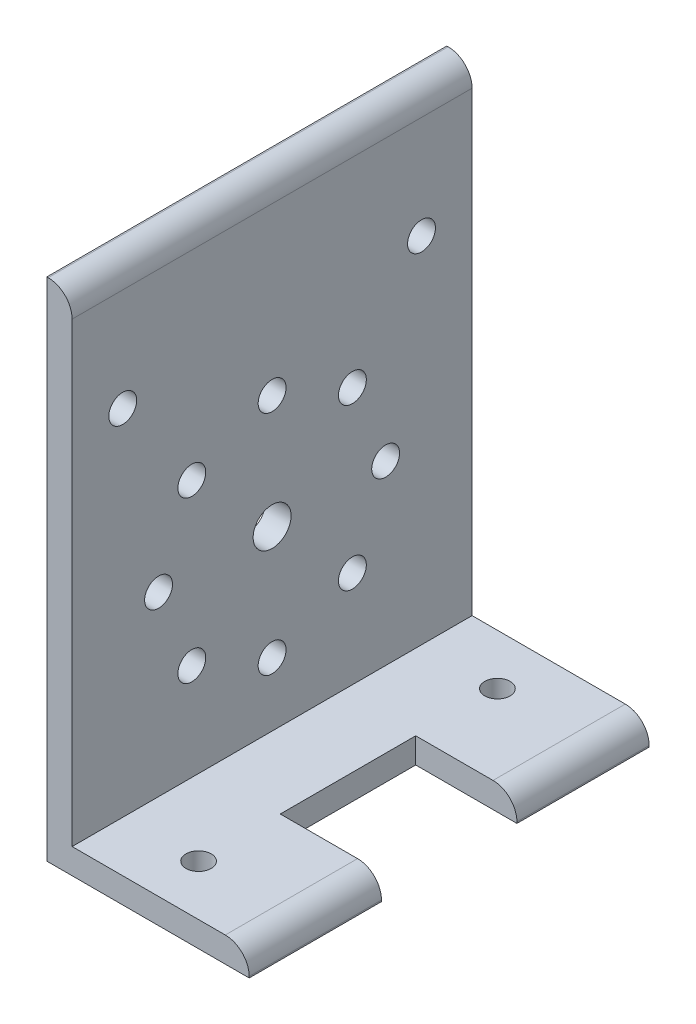
from build123d import *

# Parameters (mm, degrees)
BOSS_EXTRUDE1_DEPTH = 100.4
SKETCH2_R           = 4.7625
SKETCH2_R_2         = 3.5
CUT_EXTRUDE1_DEPTH  = 170.675572785
SKETCH3_R           = 3.175
CUT_EXTRUDE2_DEPTH  = 165.976430135
CUT_EXTRUDE3_DEPTH  = 165.976430135
SKETCH5_R           = 3.5
CUT_EXTRUDE4_DEPTH  = 10


with BuildPart() as part:
    # Sketch1 → Boss-Extrude1 (new body)
    with BuildSketch(Plane.XY):
        with BuildLine():
            Line((44.8, 6.35), (12.35, 6.35))
            Line((12.35, 6.35), (6.35, 6.35))
            Line((6.35, 6.35), (6.35, 37.75))
            Line((6.35, 37.75), (6.35, 121))
            ThreePointArc((6.35, 121), (4.592640687, 125.242640687), (0.35, 127))
            Line((0.35, 127), (0, 127))
            Line((0, 127), (0, 6.35))
            Line((0, 6.35), (0, 0))
            Line((0, 0), (6.35, 0))
            Line((6.35, 0), (50.8, 0))
            Line((50.8, 0), (50.8, 0.35))
            ThreePointArc((50.8, 0.35), (49.042640687, 4.592640687), (44.8, 6.35))
        make_face()
    extrude(amount=BOSS_EXTRUDE1_DEPTH)

    # Sketch2 → Cut-Extrude1 (cut, through all)
    with BuildSketch(Plane.ZY):
        with Locations((50.2, 50.8)):
            Circle(SKETCH2_R)
        with Locations((50.2, 79.3)):
            Circle(SKETCH2_R_2)
        with Locations((70.352543264, 70.952543264)):
            Circle(SKETCH2_R_2)
        with Locations((78.7, 50.8)):
            Circle(SKETCH2_R_2)
        with Locations((70.352543264, 30.647456736)):
            Circle(SKETCH2_R_2)
        with Locations((50.2, 22.3)):
            Circle(SKETCH2_R_2)
        with Locations((30.047456736, 30.647456736)):
            Circle(SKETCH2_R_2)
        with Locations((21.7, 50.8)):
            Circle(SKETCH2_R_2)
        with Locations((30.047456736, 70.952543264)):
            Circle(SKETCH2_R_2)
    extrude(amount=-CUT_EXTRUDE1_DEPTH, mode=Mode.SUBTRACT)

    # Sketch3 → Cut-Extrude2 (cut, through all)
    with BuildSketch(Plane(origin=(0, 6.35, 0), x_dir=(1, 0, 0), z_dir=(0, 1, 0))):
        with Locations((25.4, -12.7)):
            Circle(SKETCH3_R)
        with Locations((25.4, -87.7)):
            Circle(SKETCH3_R)
    extrude(amount=-CUT_EXTRUDE2_DEPTH, mode=Mode.SUBTRACT)

    # Sketch4 → Cut-Extrude3 (cut, through all)
    with BuildSketch(Plane(origin=(0, 6.35, 0), x_dir=(1, 0, 0), z_dir=(0, 1, 0))):
        Polygon((50.8, -50.2), (50.8, -33.2), (25.4, -33.2), (25.4, -50.2), (25.4, -67.2), (50.8, -67.2), align=None)
    extrude(amount=-CUT_EXTRUDE3_DEPTH, mode=Mode.SUBTRACT)

    # Sketch5 → Cut-Extrude4 (cut)
    with BuildSketch(Plane(origin=(6.35, 0, 0), x_dir=(0, 0, -1), z_dir=(1, 0, 0))):
        with Locations((-87.7, 95.25)):
            Circle(SKETCH5_R)
        with Locations((-12.7, 95.25)):
            Circle(SKETCH5_R)
    extrude(amount=-CUT_EXTRUDE4_DEPTH, mode=Mode.SUBTRACT)


solid = part.part
